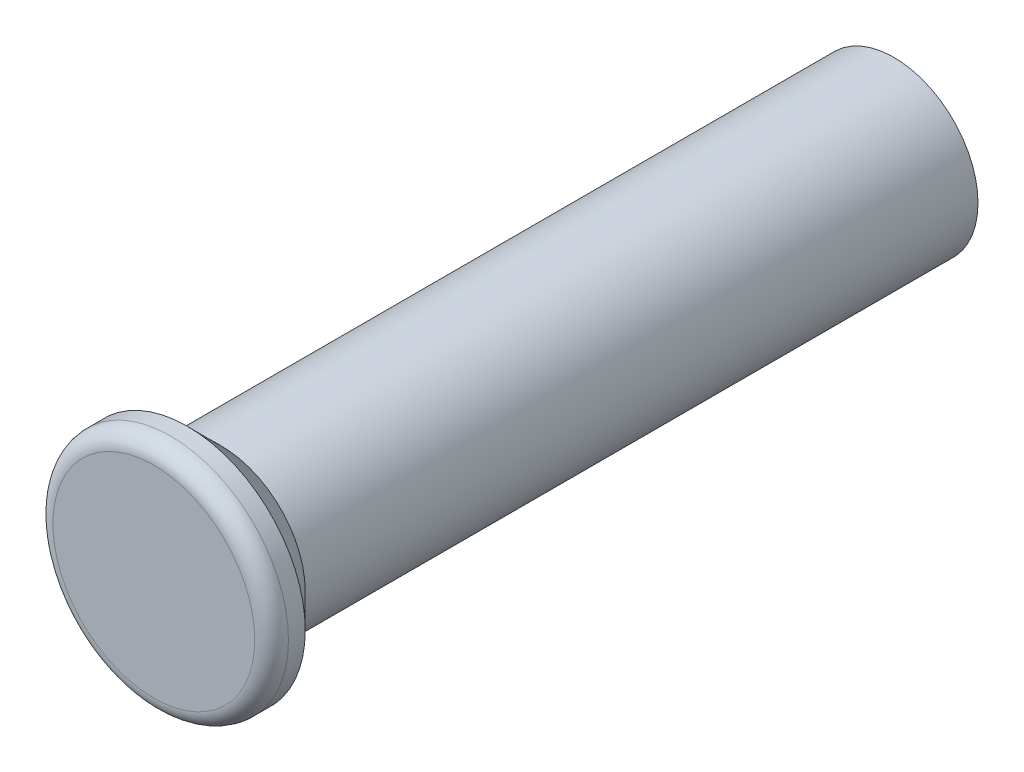
from build123d import *

# Parameters (mm, degrees)
SKETCH1_R           = 2.5
BOSS_EXTRUDE1_DEPTH = 20
SKETCH1_3_R         = 3.5
BOSS_EXTRUDE2_DEPTH = 2
CHAMFER1_SIZE       = 1
FILLET1_R           = 0.5


with BuildPart() as part:
    # Sketch1 → Boss-Extrude1 (new body)
    with BuildSketch(Plane(origin=(0, 0, 0), x_dir=(0, 1, 0), z_dir=(0, 0, 1))):
        with Locations(Location((0, 0, 0), (0, 0, 270))):
            Circle(SKETCH1_R)
    extrude(amount=-BOSS_EXTRUDE1_DEPTH)

    # Sketch1<3> → Boss-Extrude2 (add)
    with BuildSketch(Plane(origin=(0, 0, 0), x_dir=(0, 1, 0), z_dir=(0, 0, 1))):
        with Locations(Location((0, 0, 0), (0, 0, 270))):
            Circle(SKETCH1_3_R)
    extrude(amount=BOSS_EXTRUDE2_DEPTH)

    # Chamfer1
    chamfer1_edges = [part.edges().sort_by_distance(p)[0] for p in [
        (-3.5, 0, 0),
    ]]
    chamfer(chamfer1_edges, length=CHAMFER1_SIZE - 0.0001)  # a hair under: the kernel refuses the full size

    # Fillet1
    fillet1_edges = [part.edges().sort_by_distance(p)[0] for p in [
        (-3.5, 0, 2),
    ]]
    fillet(fillet1_edges, radius=FILLET1_R)


solid = part.part
